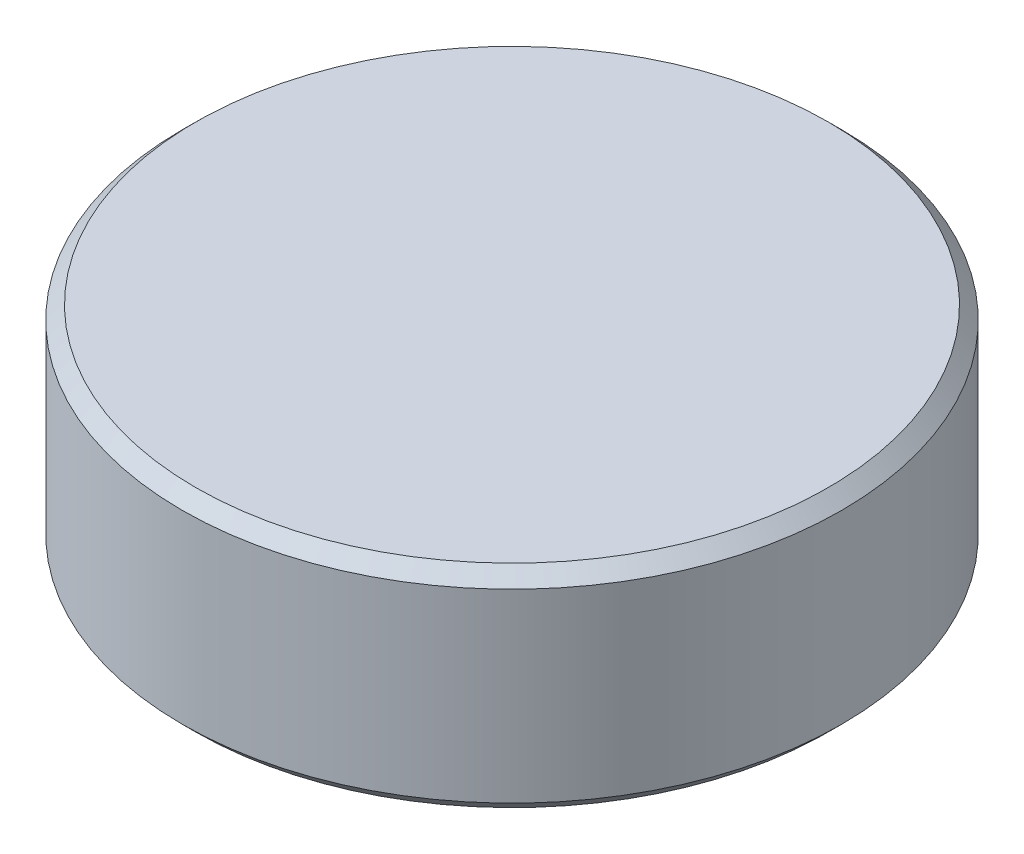
from build123d import *

# Parameters (mm, degrees)
SKETCH1_R           = 7.475
BOSS_EXTRUDE1_DEPTH = 4
SKETCH2_R           = 12.15
SKETCH2_R_2         = 10.15
BOSS_EXTRUDE2_DEPTH = 4
SKETCH3_R           = 12.2
BOSS_EXTRUDE3_DEPTH = 0.8
SKETCH4_R           = 15.763313877
SKETCH4_R_2         = 7.475
CUT_EXTRUDE1_DEPTH  = 18.908657124
SKETCH5_R           = 1.5
BOSS_EXTRUDE4_DEPTH = 1
CHAMFER1_SIZE       = 0.3


with BuildPart() as part:
    # Sketch1 → Boss-Extrude1 (new body)
    with BuildSketch(Plane(origin=(0, 0, 0), x_dir=(1, 0, 0), z_dir=(0, 1, 0))):
        Circle(SKETCH1_R)
    extrude(amount=BOSS_EXTRUDE1_DEPTH)



with BuildPart() as body_2:
    # Sketch2 → Boss-Extrude2 (new body)
    with BuildSketch(Plane(origin=(0, 0, 0), x_dir=(1, 0, 0), z_dir=(0, 1, 0))):
        Circle(SKETCH2_R)
        Circle(SKETCH2_R_2, mode=Mode.SUBTRACT)
    extrude(amount=BOSS_EXTRUDE2_DEPTH)


with BuildPart() as part_1:
    add(part.part)

    add(body_2.part)  # Boss-Extrude3 merges body 2
    # Sketch3 → Boss-Extrude3 (add)
    with BuildSketch(Plane(origin=(0, 4, 0), x_dir=(1, 0, 0), z_dir=(0, 1, 0))):
        Circle(SKETCH3_R)
    extrude(amount=BOSS_EXTRUDE3_DEPTH)

    # Sketch4 → Cut-Extrude1 (cut, through all)
    with BuildSketch(Plane.XZ):
        Circle(SKETCH4_R)
        Circle(SKETCH4_R_2, mode=Mode.SUBTRACT)
    extrude(amount=-CUT_EXTRUDE1_DEPTH, mode=Mode.SUBTRACT)

    # Sketch5 → Boss-Extrude4 (add)
    with BuildSketch(Plane.XZ):
        Circle(SKETCH5_R)
    extrude(amount=BOSS_EXTRUDE4_DEPTH)

    # Chamfer1
    chamfer1_edges = [part_1.edges().sort_by_distance(p)[0] for p in [
        (-7.475, 4.8, 0),
        (-7.475, 0, 0),
    ]]
    chamfer(chamfer1_edges, length=CHAMFER1_SIZE)


solid = part_1.part
